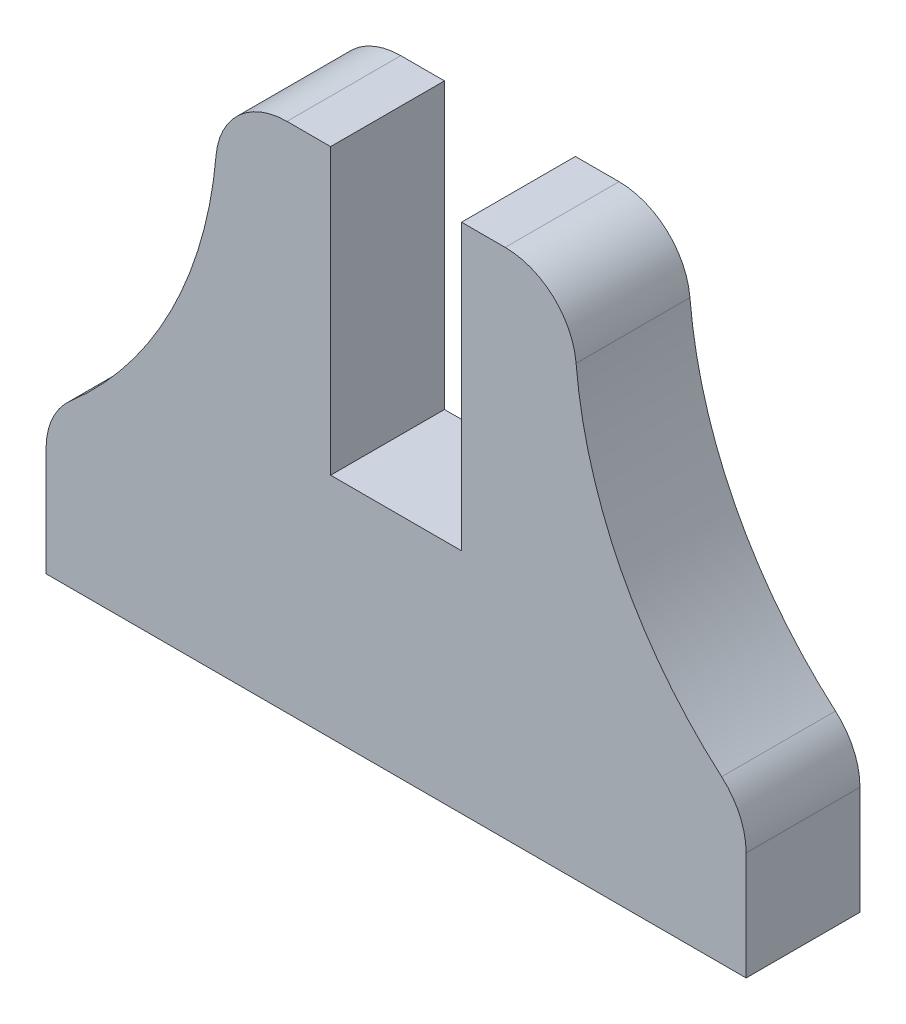
from build123d import *

# Parameters (mm, degrees)
BOSS_EXTRUDE1_DEPTH = 4


with BuildPart() as part:
    # Sketch1 → Boss-Extrude1 (new body)
    with BuildSketch(Plane.XY):
        with BuildLine():
            Line((-4.3, -163.684305639), (-4.3, -173.684305639))
            Line((-4.3, -173.684305639), (0.3, -173.684305639))
            Line((0.3, -173.684305639), (0.3, -163.684305639))
            Line((0.3, -163.684305639), (1.834666506, -163.684305639))
            ThreePointArc((1.834666506, -163.684305639), (3.5237182, -164.341182101), (4.325171253, -165.96662214))
            ThreePointArc((4.325171253, -165.96662214), (5.906128825, -171.476316112), (9.438314248, -175.990717584))
            ThreePointArc((9.438314248, -175.990717584), (10.074399439, -176.841245909), (10.3, -177.879083657))
            Line((10.3, -177.879083657), (10.3, -181.684305639))
            Line((10.3, -181.684305639), (0.3, -181.684305639))
            Line((0.3, -181.684305639), (-4.3, -181.684305639))
            Line((-4.3, -181.684305639), (-14.3, -181.684305639))
            Line((-14.3, -181.684305639), (-14.3, -177.879083657))
            ThreePointArc((-14.3, -177.879083657), (-14.074399439, -176.841245909), (-13.438314248, -175.990717584))
            ThreePointArc((-13.438314248, -175.990717584), (-9.906128825, -171.476316112), (-8.325171253, -165.96662214))
            ThreePointArc((-8.325171253, -165.96662214), (-7.5237182, -164.341182101), (-5.834666506, -163.684305639))
            Line((-5.834666506, -163.684305639), (-4.3, -163.684305639))
        make_face()
    extrude(amount=BOSS_EXTRUDE1_DEPTH)


solid = part.part
